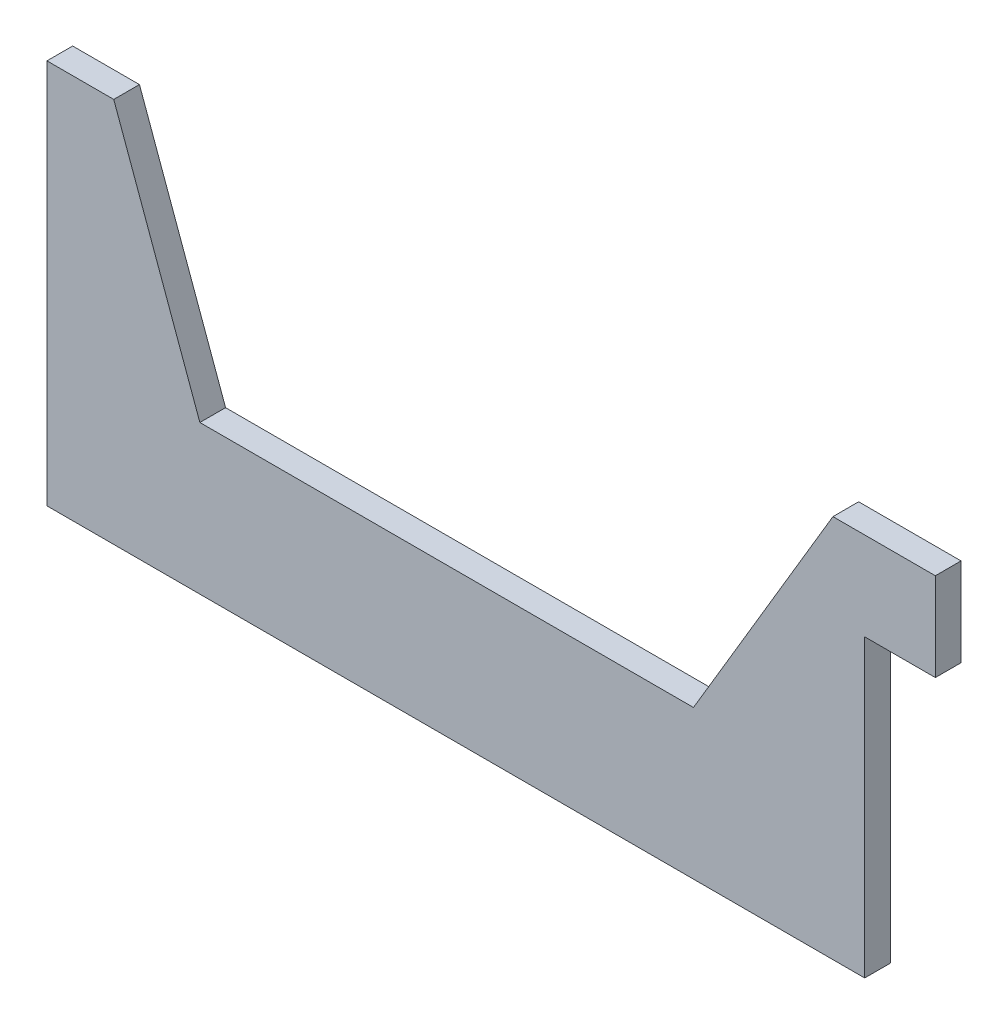
from build123d import *

# Parameters (mm, degrees)
BOSS_EXTRUDE1_DEPTH = 2


with BuildPart() as part:
    # Sketch1 → Boss-Extrude1 (new, symmetric)
    with BuildSketch(Plane.XY):
        Polygon((-60.75, -30), (-60.75, 30), (-50.352877454, 30), (-36.945370579, -6.855179418), (39.897088693, -6.855179418), (61.606830496, 29.73214036), (77.549740604, 29.73214036), (77.549740604, 16), (66.549740604, 16), (66.549740604, -30), align=None)
    extrude(amount=BOSS_EXTRUDE1_DEPTH, both=True)


solid = part.part
